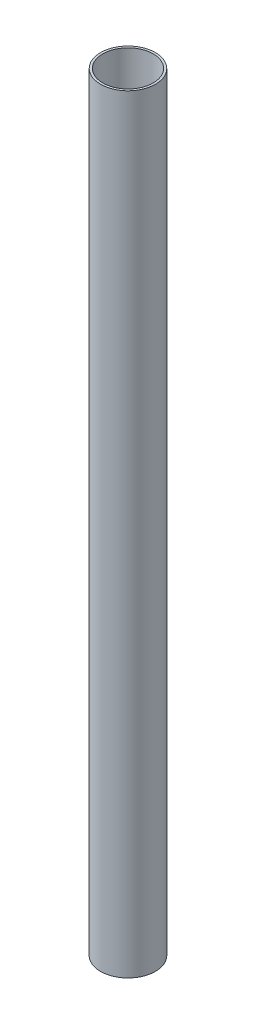
from build123d import *

# Parameters (mm, degrees)
SKETCH1_R           = 12.5
SKETCH1_R_2         = 11.5
BOSS_EXTRUDE1_DEPTH = 350


with BuildPart() as part:
    # Sketch1 → Boss-Extrude1 (new body)
    with BuildSketch(Plane(origin=(0, 0, 0), x_dir=(1, 0, 0), z_dir=(0, 1, 0))):
        Circle(SKETCH1_R)
        Circle(SKETCH1_R_2, mode=Mode.SUBTRACT)
    extrude(amount=BOSS_EXTRUDE1_DEPTH)


solid = part.part
